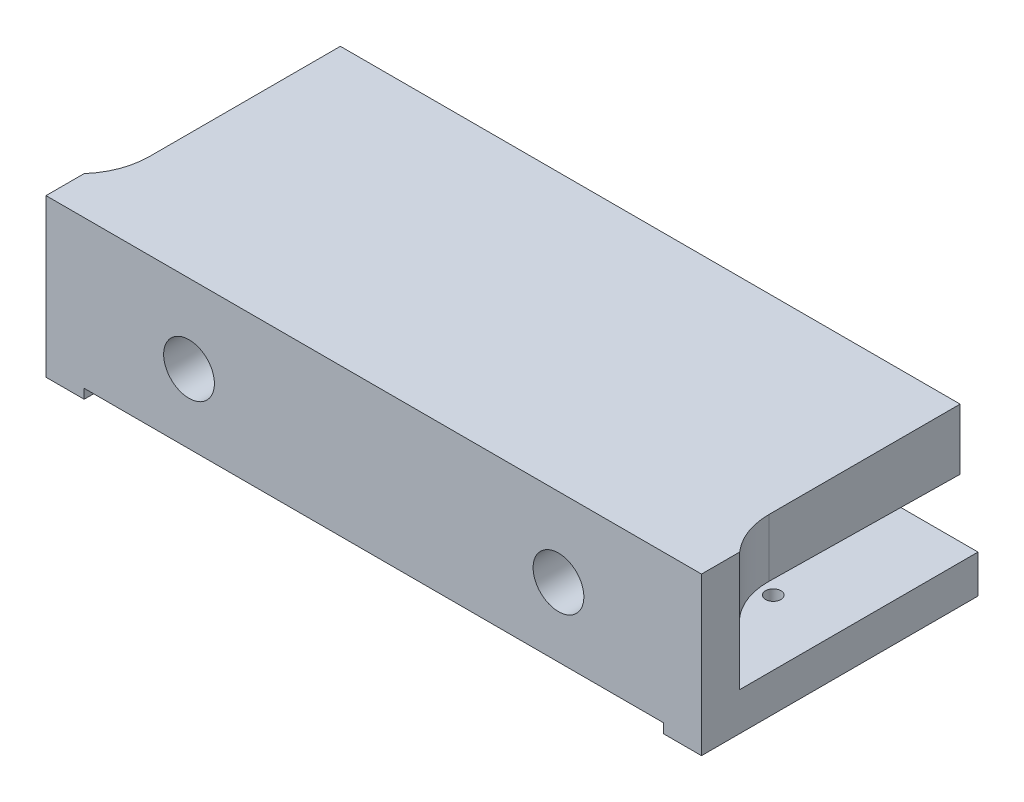
from build123d import *

# Parameters (mm, degrees)
SKETCH1_W               = 69.85
SKETCH1_H               = 29.464
BOSS_EXTRUDE1_DEPTH     = 16.764
SKETCH2_W               = 25.4
SKETCH2_H               = 6.35
CUT_EXTRUDE1_DEPTH      = 69.85
SKETCH3_W               = 25.4
SKETCH3_H               = 6.35
CUT_EXTRUDE2_DEPTH      = 50.8
SKETCH5_W               = 61.722
SKETCH5_H               = 17.1196
CUT_EXTRUDE3_DEPTH      = 1.016
SKETCH5_3_R             = 0.81915
CUT_EXTRUDE4_DEPTH      = 42.446581825
SKETCH7_W               = 69.85
SKETCH7_H               = 7.62
BOSS_EXTRUDE2_DEPTH     = 25.4
CUT_EXTRUDE9_DEPTH      = 74.328616651
CUT_EXTRUDE9_DEPTH_BACK = 74.328616651
SKETCH13_R              = 2.7051
CUT_EXTRUDE12_DEPTH     = 4.064
SKETCH17_W              = 1.905
SKETCH17_H              = 6.477
CUT_EXTRUDE13_DEPTH     = 25.4
FILLET1_R               = 7.62


with BuildPart() as part:
    # Sketch1 → Boss-Extrude1 (new body)
    with BuildSketch(Plane(origin=(0, 0, 0), x_dir=(1, 0, 0), z_dir=(0, 1, 0))):
        Rectangle(SKETCH1_W, SKETCH1_H)
    extrude(amount=BOSS_EXTRUDE1_DEPTH)

    # Sketch2 → Cut-Extrude1 (cut)
    with BuildSketch(Plane.ZY.offset(34.925)):
        with Locations((-2.032, 7.239)):
            Rectangle(SKETCH2_W, SKETCH2_H)
    extrude(amount=-CUT_EXTRUDE1_DEPTH, mode=Mode.SUBTRACT)

    # Sketch3 → Cut-Extrude2 (cut)
    with BuildSketch(Plane.ZY.offset(34.925)):
        with Locations((-2.032, 13.589)):
            Rectangle(SKETCH3_W, SKETCH3_H)
    cut_extrude2 = extrude(amount=-CUT_EXTRUDE2_DEPTH, mode=Mode.SUBTRACT)

    # Mirror1: Cut-Extrude2 across plane
    add(cut_extrude2.mirror(Plane(origin=(0, 0, 0), x_dir=(0, 0, 1), z_dir=(1, 0, 0))), mode=Mode.SUBTRACT)

    # Sketch5 → Cut-Extrude3 (cut)
    with BuildSketch(Plane.XZ):
        with Locations((0, 6.1722)):
            Rectangle(SKETCH5_W, SKETCH5_H)
    extrude(amount=-CUT_EXTRUDE3_DEPTH, mode=Mode.SUBTRACT)

    # Sketch5<3> → Cut-Extrude4 (cut, through all)
    with BuildSketch(Plane.XZ):
        with Locations(Location((-27.9908, 0.1524, 0), (0, 0, 270))):
            Circle(SKETCH5_3_R)
        with Locations(Location((27.9908, 0.1524, 0), (0, 0, 270))):
            Circle(SKETCH5_3_R)
    extrude(amount=-CUT_EXTRUDE4_DEPTH, mode=Mode.SUBTRACT)

    # Sketch7 → Boss-Extrude2 (add)
    with BuildSketch(Plane(origin=(0, 0, 10.668), x_dir=(-1, 0, 0), z_dir=(0, 0, -1))):
        with Locations((0, 12.954)):
            Rectangle(SKETCH7_W, SKETCH7_H)
    extrude(amount=BOSS_EXTRUDE2_DEPTH)

    # Sketch8 → Cut-Extrude9 (cut, two sides: drawn at the far end of the back side and taken through both)
    with BuildSketch(Plane.ZY.offset(34.925).offset(-CUT_EXTRUDE9_DEPTH_BACK)):
        Polygon((-14.732, 10.287), (10.668, 10.668), (10.668, 9.144), (-14.732, 9.144), align=None)
    extrude(amount=CUT_EXTRUDE9_DEPTH + CUT_EXTRUDE9_DEPTH_BACK, mode=Mode.SUBTRACT)

    # Sketch13 → Cut-Extrude12 (cut)
    with BuildSketch(Plane.XY.offset(14.732)):
        with Locations((-19.685, 8.382)):
            Circle(SKETCH13_R)
        with Locations((19.685, 8.382)):
            Circle(SKETCH13_R)
    extrude(amount=-CUT_EXTRUDE12_DEPTH, mode=Mode.SUBTRACT)

    # Sketch17 → Cut-Extrude13 (cut)
    with BuildSketch(Plane(origin=(0, 0, -14.732), x_dir=(-1, 0, 0), z_dir=(0, 0, -1))):
        with Locations((-33.9725, 13.5255)):
            Rectangle(SKETCH17_W, SKETCH17_H)
        with Locations((33.9725, 13.5255)):
            Rectangle(SKETCH17_W, SKETCH17_H)
    extrude(amount=-CUT_EXTRUDE13_DEPTH, mode=Mode.SUBTRACT)

    # Fillet1
    # the kernel refuses this fillet: 7.62 mm, written as the material it adds along each edge
    with BuildSketch(Plane(origin=(-33.02, 16.764, 10.668), x_dir=(0, 0, -1), z_dir=(0, -1, 0))) as fillet1_piece_1_section:
        with BuildLine():
            CenterArc((5.040156248, -7.62), FILLET1_R, 90, 41.409622109)
            Line((0, -1.905), (-0.100803125, -1.7907))
            ThreePointArc((-0.100803125, -1.7907), (-0.1524, -0.9525), (-0.1524, 0))
            Line((-0.1524, 0), (0, 0.1524))
            Line((0, 0.1524), (5.040156248, 0.1524))
            Line((5.040156248, 0.1524), (5.040156248, 0))
        make_face()
    fillet1_piece_1 = extrude(amount=18.696390619, mode=Mode.PRIVATE)
    fillet1_piece_1 = split(fillet1_piece_1, bisect_by=Plane(origin=(-33.474653721, 10.647897951, 9.327863423), z_dir=(0, 0.9998875189808162, -0.014998312784712252)), keep=Keep.TOP, mode=Mode.PRIVATE)
    add(fillet1_piece_1)
    with BuildSketch(Plane(origin=(33.02, -1.932390619, 10.668), x_dir=(0, 0, -1), z_dir=(0, 1, 0))) as fillet1_piece_2_section:
        with BuildLine():
            CenterArc((5.040156248, -7.62), FILLET1_R, 90, 41.409622109)
            Line((0, -1.905), (-0.100803125, -1.7907))
            ThreePointArc((-0.100803125, -1.7907), (-0.1524, -0.9525), (-0.1524, 0))
            Line((-0.1524, 0), (0, 0.1524))
            Line((0, 0.1524), (5.040156248, 0.1524))
            Line((5.040156248, 0.1524), (5.040156248, 0))
        make_face()
    fillet1_piece_2 = extrude(amount=18.696390619, mode=Mode.PRIVATE)
    fillet1_piece_2 = split(fillet1_piece_2, bisect_by=Plane(origin=(33.474653721, 10.647897951, 9.327863423), z_dir=(0, 0.9998875189808162, -0.014998312784712252)), keep=Keep.TOP, mode=Mode.PRIVATE)
    add(fillet1_piece_2)


solid = part.part
